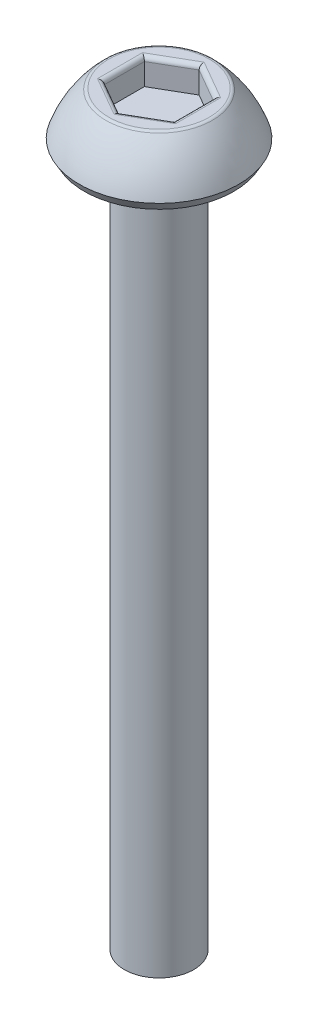
from build123d import *

# Parameters (mm, degrees)
CUT_EXTRUDE1_DEPTH = 0.75
FILLET1_R          = 0.125


with BuildPart() as part:
    # Sketch1 → Revolve1 (revolve)
    with BuildSketch(Plane(origin=(0, 0, 0), x_dir=(0, 0, -1), z_dir=(1, 0, 0))):
        with BuildLine():
            Line((0, 1.5), (-1.5, 1.5))
            ThreePointArc((-1.5, 1.5), (-1.978515811, 0.925250119), (-2.3, 0.25))
            Line((-2.3, 0.25), (-2.155662433, 0))
            Line((-2.155662433, 0), (-1, 0))
            Line((-1, 0), (-1, -20))
            Line((-1, -20), (0, -20))
            Line((0, -20), (0, 1.5))
        make_face()
    revolve(axis=Axis((0, -20, 0), (0, 1, 0)))

    # Sketch2 → Cut-Extrude1 (cut)
    with BuildSketch(Plane(origin=(0, 1.5, 0), x_dir=(1, 0, 0), z_dir=(0, 1, 0))):
        Polygon((0, 1.154700538), (-1, 0.577350269), (-1, -0.577350269), (0, -1.154700538), (1, -0.577350269), (1, 0.577350269), align=None)
    extrude(amount=-CUT_EXTRUDE1_DEPTH, mode=Mode.SUBTRACT)

    # Fillet1
    fillet1_edges = [part.edges().sort_by_distance(p)[0] for p in [
        (0, 1.5, -1.5),
        (-0.5, 1.5, 0.866025404),
        (0.5, 1.5, 0.866025404),
        (1, 1.5, 0),
        (0.5, 1.5, -0.866025404),
        (-0.5, 1.5, -0.866025404),
        (-1, 1.5, 0),
    ]]
    fillet(fillet1_edges, radius=FILLET1_R)


solid = part.part
